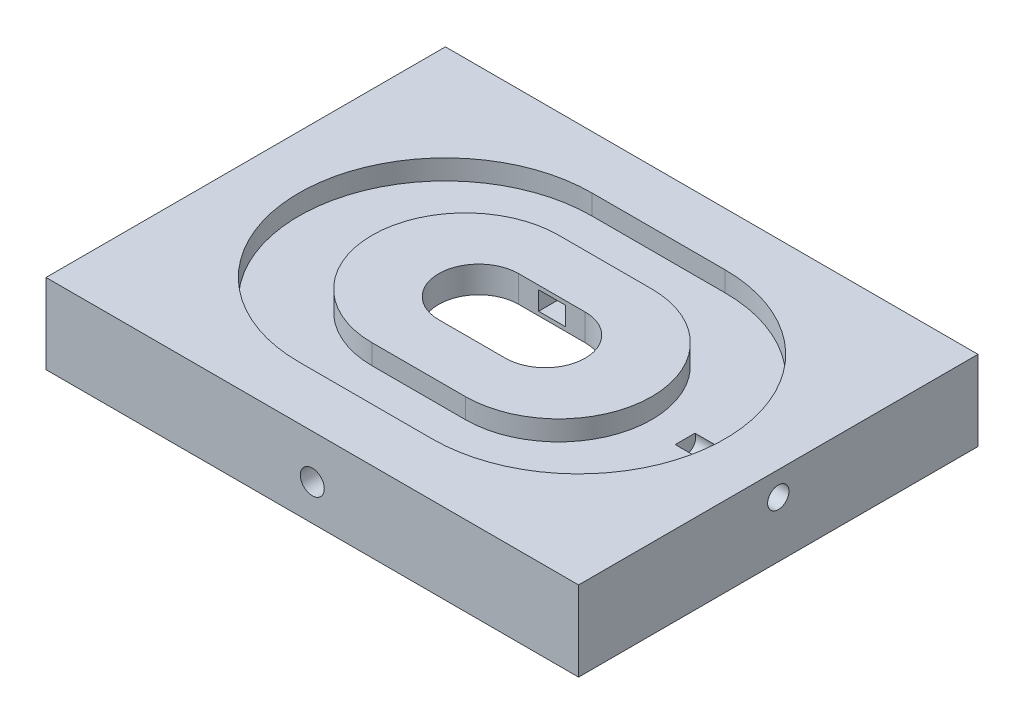
from build123d import *

# Parameters (mm, degrees)
SKETCH1_W           = 20
SKETCH1_H           = 15
BOSS_EXTRUDE1_DEPTH = 3
CUT_EXTRUDE1_DEPTH  = 0.75
CUT_EXTRUDE2_DEPTH  = 26.179356624
SKETCH7_R           = 0.4
CUT_EXTRUDE6_DEPTH  = 3.5
SKETCH14_W          = 1
SKETCH14_H          = 0.7
CUT_EXTRUDE7_DEPTH  = 0.75
SKETCH15_R          = 0.45
CUT_EXTRUDE8_DEPTH  = 3.1
CUT_EXTRUDE9_START  = -3.1
SKETCH16_R          = 0.45
CUT_EXTRUDE9_DEPTH  = 3.1
SKETCH17_W          = 1
SKETCH17_H          = 0.7
CUT_EXTRUDE10_DEPTH = 0.75


with BuildPart() as part:
    # Sketch1 → Boss-Extrude1 (new body)
    with BuildSketch(Plane(origin=(0, 0, 0), x_dir=(1, 0, 0), z_dir=(0, 1, 0))):
        with Locations((10, 7.5)):
            Rectangle(SKETCH1_W, SKETCH1_H)
    extrude(amount=BOSS_EXTRUDE1_DEPTH)

    # Sketch2 → Cut-Extrude1 (cut)
    with BuildSketch(Plane(origin=(0, 3, 0), x_dir=(1, 0, 0), z_dir=(0, 1, 0))):
        with BuildLine():
            Line((7.5, 13), (12.5, 13))
            ThreePointArc((12.5, 13), (18, 7.5), (12.5, 2))
            Line((12.5, 2), (7.5, 2))
            ThreePointArc((7.5, 2), (2, 7.5), (7.5, 13))
        make_face()
        with BuildLine():
            Line((8.25, 11), (11.75, 11))
            ThreePointArc((11.75, 11), (15.25, 7.5), (11.75, 4))
            Line((11.75, 4), (8.25, 4))
            ThreePointArc((8.25, 4), (4.75, 7.5), (8.25, 11))
        make_face(mode=Mode.SUBTRACT)
    extrude(amount=-CUT_EXTRUDE1_DEPTH, mode=Mode.SUBTRACT)

    # Sketch2<3> → Cut-Extrude2 (cut, through all)
    with BuildSketch(Plane(origin=(0, 3, 0), x_dir=(1, 0, 0), z_dir=(0, 1, 0))):
        with BuildLine():
            Line((8.75, 6), (11.25, 6))
            ThreePointArc((11.25, 6), (12.75, 7.5), (11.25, 9))
            Line((11.25, 9), (8.75, 9))
            ThreePointArc((8.75, 9), (7.25, 7.5), (8.75, 6))
        make_face()
    extrude(amount=-CUT_EXTRUDE2_DEPTH, mode=Mode.SUBTRACT)

    # Sketch7 → Cut-Extrude6 (cut, symmetric)
    with BuildSketch(Plane(origin=(20, 0, 0), x_dir=(0, 0, -1), z_dir=(1, 0, 0))):
        with Locations(Location((7.5, 2.1, 0), (0, 0, 22.024312837))):
            Circle(SKETCH7_R)
    extrude(amount=CUT_EXTRUDE6_DEPTH, both=True, mode=Mode.SUBTRACT)

    # Sketch8 → Cut-Loft1 section 0
    with BuildSketch(Plane.XZ):
        with BuildLine():
            Line((5.5, -2.5), (14.5, -2.5))
            ThreePointArc((14.5, -2.5), (19.5, -7.5), (14.5, -12.5))
            Line((14.5, -12.5), (5.5, -12.5))
            ThreePointArc((5.5, -12.5), (0.5, -7.5), (5.5, -2.5))
        make_face()
    # Sketch9 → Cut-Loft1 section 1
    with BuildSketch(Plane(origin=(0, 2, 0), x_dir=(1, 0, 0), z_dir=(0, 1, 0))):
        with BuildLine():
            Line((7.25, 9.9), (12.75, 9.9))
            ThreePointArc((12.75, 9.9), (15.15, 7.5), (12.75, 5.1))
            Line((12.75, 5.1), (7.25, 5.1))
            ThreePointArc((7.25, 5.1), (4.85, 7.5), (7.25, 9.9))
        make_face()
    loft(mode=Mode.SUBTRACT)

    # Sketch14 → Cut-Extrude7 (cut)
    with BuildSketch(Plane(origin=(0, 0, -6), x_dir=(-1, 0, 0), z_dir=(0, 0, -1))):
        with Locations((-10, 2.5)):
            Rectangle(SKETCH14_W, SKETCH14_H)
    extrude(amount=-CUT_EXTRUDE7_DEPTH, mode=Mode.SUBTRACT)

    # Sketch15 → Cut-Extrude8 (cut)
    with BuildSketch(Plane.XY):
        with Locations((10, 1.35)):
            Circle(SKETCH15_R)
    extrude(amount=-CUT_EXTRUDE8_DEPTH, mode=Mode.SUBTRACT)

    # Sketch16 → Cut-Extrude9 (cut)
    with BuildSketch(Plane(origin=(0, 0, -15), x_dir=(-1, 0, 0), z_dir=(0, 0, -1)).offset(CUT_EXTRUDE9_START)):
        with Locations(Location((-10, 1.35, 0), (0, 0, 180))):
            Circle(SKETCH16_R)
    extrude(amount=CUT_EXTRUDE9_DEPTH, mode=Mode.SUBTRACT)

    # Sketch17 → Cut-Extrude10 (cut)
    with BuildSketch(Plane.XY.offset(-9)):
        with Locations((10, 2.5)):
            Rectangle(SKETCH17_W, SKETCH17_H)
    extrude(amount=-CUT_EXTRUDE10_DEPTH, mode=Mode.SUBTRACT)

    # Cut-Loft6: read off the stored shape, not the designer's step
    # Cut-Loft6: loft between two sections, ruled curve by curve
    cut_loft6_from = [
        Edge.make_bspline([(10.5, 2.85, -5.25), (10.416666667, 2.85, -5.25), (10.333333333, 2.85, -5.25), (10.166666667, 2.85, -5.25), (10.083333333, 2.85, -5.25), (9.916666667, 2.85, -5.25), (9.833333333, 2.85, -5.25), (9.666666667, 2.85, -5.25), (9.583333333, 2.85, -5.25), (9.5, 2.85, -5.25)], [0, 0, 0, 0, 0.25, 0.25, 0.5, 0.5, 0.75, 0.75, 1, 1, 1, 1], 3),
        Edge.make_bspline([(9.5, 2.85, -5.25), (9.5, 2.733333333, -5.25), (9.5, 2.616666667, -5.25), (9.5, 2.383333333, -5.25), (9.5, 2.266666667, -5.25), (9.5, 2.15, -5.25)], [0, 0, 0, 0, 0.5, 0.5, 1, 1, 1, 1], 3),
        Edge.make_bspline([(10.5, 2.15, -5.25), (10.5, 2.266666667, -5.25), (10.5, 2.383333333, -5.25), (10.5, 2.616666667, -5.25), (10.5, 2.733333333, -5.25), (10.5, 2.85, -5.25)], [0, 0, 0, 0, 0.5, 0.5, 1, 1, 1, 1], 3),
        Edge.make_bspline([(9.5, 2.15, -5.25), (9.583333333, 2.15, -5.25), (9.666666667, 2.15, -5.25), (9.833333333, 2.15, -5.25), (9.916666667, 2.15, -5.25), (10.083333333, 2.15, -5.25), (10.166666667, 2.15, -5.25), (10.333333333, 2.15, -5.25), (10.416666667, 2.15, -5.25), (10.5, 2.15, -5.25)], [0, 0, 0, 0, 0.25, 0.25, 0.5, 0.5, 0.75, 0.75, 1, 1, 1, 1], 3),
    ]
    cut_loft6_to = [
        Edge.make_bspline([(10.368654364, 1.608058055, -3.1), (10.333419465, 1.658393625, -3.1), (10.283281513, 1.707213189, -3.1), (10.155567455, 1.778542233, -3.1), (10.078098334, 1.8, -3.1), (9.921901666, 1.8, -3.1), (9.844432545, 1.778542233, -3.1), (9.716718487, 1.707213189, -3.1), (9.666580535, 1.658393625, -3.1), (9.631345636, 1.608058055, -3.1)], [0, 0, 0, 0, 0.25, 0.25, 0.5, 0.5, 0.75, 0.75, 1, 1, 1, 1], 3),
        Edge.make_bspline([(9.631345636, 1.608058055, -3.1), (9.582016777, 1.537588256, -3.1), (9.55, 1.444566669, -3.1), (9.55, 1.255433331, -3.1), (9.582016777, 1.162411744, -3.1), (9.631345636, 1.091941945, -3.1)], [0, 0, 0, 0, 0.5, 0.5, 1, 1, 1, 1], 3),
        Edge.make_bspline([(10.368654364, 1.091941945, -3.1), (10.417983223, 1.162411744, -3.1), (10.45, 1.255433331, -3.1), (10.45, 1.444566669, -3.1), (10.417983223, 1.537588256, -3.1), (10.368654364, 1.608058055, -3.1)], [0, 0, 0, 0, 0.5, 0.5, 1, 1, 1, 1], 3),
        Edge.make_bspline([(9.631345636, 1.091941945, -3.1), (9.666580535, 1.041606375, -3.1), (9.716718487, 0.992786811, -3.1), (9.844432545, 0.921457767, -3.1), (9.921901666, 0.9, -3.1), (10.078098334, 0.9, -3.1), (10.155567455, 0.921457767, -3.1), (10.283281513, 0.992786811, -3.1), (10.333419465, 1.041606375, -3.1), (10.368654364, 1.091941945, -3.1)], [0, 0, 0, 0, 0.25, 0.25, 0.5, 0.5, 0.75, 0.75, 1, 1, 1, 1], 3),
    ]
    cut_loft6 = Solid(Shell([*[Face.make_surface_from_curves(cut_loft6_from[k], cut_loft6_to[k]) for k in range(4)], Face(Wire(cut_loft6_from)), Face(Wire(cut_loft6_to))]))
    add(cut_loft6, mode=Mode.SUBTRACT)

    # Cut-Loft8: read off the stored shape, not the designer's step
    # Cut-Loft8: loft between two sections, ruled curve by curve
    cut_loft8_from = [
        Edge.make_bspline([(10.5, 2.85, -9.75), (10.5, 2.733333333, -9.75), (10.5, 2.616666667, -9.75), (10.5, 2.383333333, -9.75), (10.5, 2.266666667, -9.75), (10.5, 2.15, -9.75)], [0, 0, 0, 0, 0.5, 0.5, 1, 1, 1, 1], 3),
        Edge.make_bspline([(10.5, 2.15, -9.75), (10.416666667, 2.15, -9.75), (10.333333333, 2.15, -9.75), (10.166666667, 2.15, -9.75), (10.083333333, 2.15, -9.75), (9.916666667, 2.15, -9.75), (9.833333333, 2.15, -9.75), (9.666666667, 2.15, -9.75), (9.583333333, 2.15, -9.75), (9.5, 2.15, -9.75)], [0, 0, 0, 0, 0.25, 0.25, 0.5, 0.5, 0.75, 0.75, 1, 1, 1, 1], 3),
        Edge.make_bspline([(9.5, 2.85, -9.75), (9.583333333, 2.85, -9.75), (9.666666667, 2.85, -9.75), (9.833333333, 2.85, -9.75), (9.916666667, 2.85, -9.75), (10.083333333, 2.85, -9.75), (10.166666667, 2.85, -9.75), (10.333333333, 2.85, -9.75), (10.416666667, 2.85, -9.75), (10.5, 2.85, -9.75)], [0, 0, 0, 0, 0.25, 0.25, 0.5, 0.5, 0.75, 0.75, 1, 1, 1, 1], 3),
        Edge.make_bspline([(9.5, 2.15, -9.75), (9.5, 2.266666667, -9.75), (9.5, 2.383333333, -9.75), (9.5, 2.616666667, -9.75), (9.5, 2.733333333, -9.75), (9.5, 2.85, -9.75)], [0, 0, 0, 0, 0.5, 0.5, 1, 1, 1, 1], 3),
    ]
    cut_loft8_to = [
        Edge.make_bspline([(10.368654364, 1.608058055, -11.9), (10.417983223, 1.537588256, -11.9), (10.45, 1.444566669, -11.9), (10.45, 1.255433331, -11.9), (10.417983223, 1.162411744, -11.9), (10.368654364, 1.091941945, -11.9)], [0, 0, 0, 0, 0.5, 0.5, 1, 1, 1, 1], 3),
        Edge.make_bspline([(10.368654364, 1.091941945, -11.9), (10.333419465, 1.041606375, -11.9), (10.283281513, 0.992786811, -11.9), (10.155567455, 0.921457767, -11.9), (10.078098334, 0.9, -11.9), (9.921901666, 0.9, -11.9), (9.844432545, 0.921457767, -11.9), (9.716718487, 0.992786811, -11.9), (9.666580535, 1.041606375, -11.9), (9.631345636, 1.091941945, -11.9)], [0, 0, 0, 0, 0.25, 0.25, 0.5, 0.5, 0.75, 0.75, 1, 1, 1, 1], 3),
        Edge.make_bspline([(9.631345636, 1.608058055, -11.9), (9.666580535, 1.658393625, -11.9), (9.716718487, 1.707213189, -11.9), (9.844432545, 1.778542233, -11.9), (9.921901666, 1.8, -11.9), (10.078098334, 1.8, -11.9), (10.155567455, 1.778542233, -11.9), (10.283281513, 1.707213189, -11.9), (10.333419465, 1.658393625, -11.9), (10.368654364, 1.608058055, -11.9)], [0, 0, 0, 0, 0.25, 0.25, 0.5, 0.5, 0.75, 0.75, 1, 1, 1, 1], 3),
        Edge.make_bspline([(9.631345636, 1.091941945, -11.9), (9.582016777, 1.162411744, -11.9), (9.55, 1.255433331, -11.9), (9.55, 1.444566669, -11.9), (9.582016777, 1.537588256, -11.9), (9.631345636, 1.608058055, -11.9)], [0, 0, 0, 0, 0.5, 0.5, 1, 1, 1, 1], 3),
    ]
    cut_loft8 = Solid(Shell([*[Face.make_surface_from_curves(cut_loft8_from[k], cut_loft8_to[k]) for k in range(4)], Face(Wire(cut_loft8_from)), Face(Wire(cut_loft8_to))]))
    add(cut_loft8, mode=Mode.SUBTRACT)


solid = part.part
